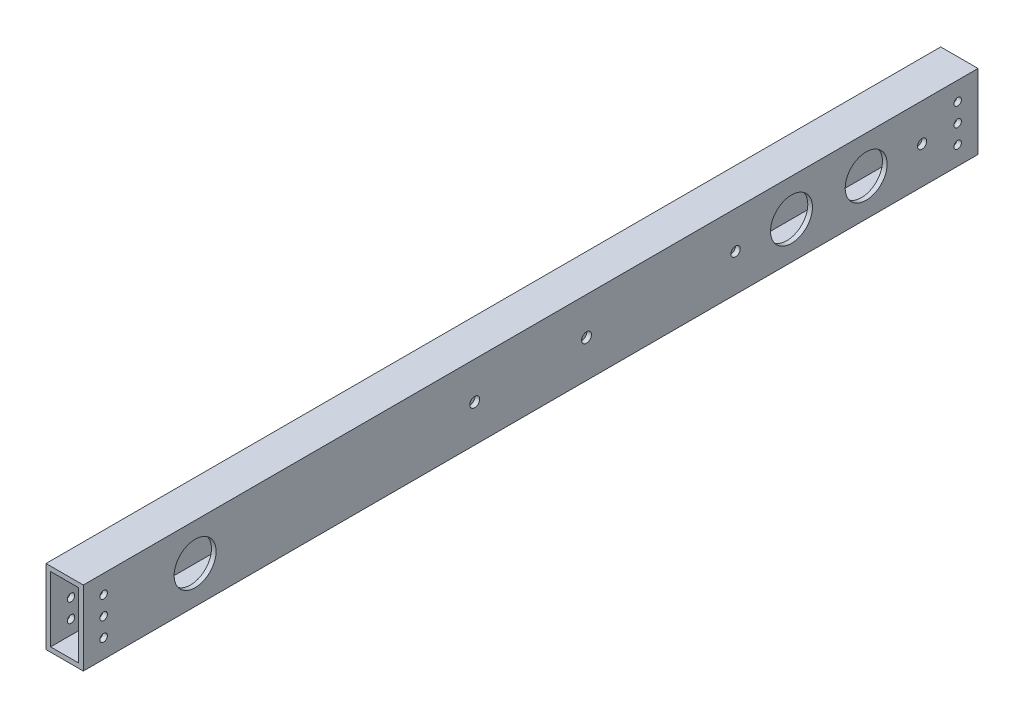
from build123d import *

# Parameters (mm, degrees)
SKETCH1_W               = 25.4
SKETCH1_H               = 50.8
SKETCH1_W_2             = 19.05
SKETCH1_H_2             = 44.45
BOSS_EXTRUDE1_DEPTH     = 304.8
F_10_CLEARANCE_HOLE1_D  = 5.1054
F_1_4_CLEARANCE_HOLE2_D = 6.7564
SKETCH7_R               = 14.2875
SKETCH7_R_2             = 3.175
CUT_EXTRUDE1_DEPTH      = 307.909367729


with BuildPart() as part:
    # Sketch1 → Boss-Extrude1 (new, symmetric)
    with BuildSketch(Plane.XY):
        Rectangle(SKETCH1_W, SKETCH1_H)
        Rectangle(SKETCH1_W_2, SKETCH1_H_2, mode=Mode.SUBTRACT)
    extrude(amount=BOSS_EXTRUDE1_DEPTH, both=True)

    # #10 Clearance Hole1 (through all)
    with Locations(Plane(origin=(12.7, 0, 0), x_dir=(0, 0, -1), z_dir=(1, 0, 0))):
        with Locations((-290.940864397, 12.7), (-290.940864397, 0), (-290.940864397, -12.7)):
            f_10_clearance_hole1 = Hole(F_10_CLEARANCE_HOLE1_D / 2)

    # Mirror1: #10 Clearance Hole1 across plane
    add(f_10_clearance_hole1.mirror(Plane.XY), mode=Mode.SUBTRACT)

    # 1/4 Clearance Hole2 (through all)
    with Locations(Plane(origin=(12.7, 0, 0), x_dir=(0, 0, -1), z_dir=(1, 0, 0))):
        with Locations((-38.1, 0), (38.1, 0)):
            Hole(F_1_4_CLEARANCE_HOLE2_D / 2)

    # Sketch7 → Cut-Extrude1 (cut, through all)
    with BuildSketch(Plane(origin=(12.7, 0, 0), x_dir=(0, 0, -1), z_dir=(1, 0, 0))):
        with Locations((-228.6, 0)):
            Circle(SKETCH7_R)
        with Locations((177.7238, 0)):
            Circle(SKETCH7_R)
        with Locations((228.6, 0)):
            Circle(SKETCH7_R)
        with Locations((139.6238, 0)):
            Circle(SKETCH7_R_2)
        with Locations((266.7, 0)):
            Circle(SKETCH7_R_2)
    extrude(amount=-CUT_EXTRUDE1_DEPTH, mode=Mode.SUBTRACT)


solid = part.part
